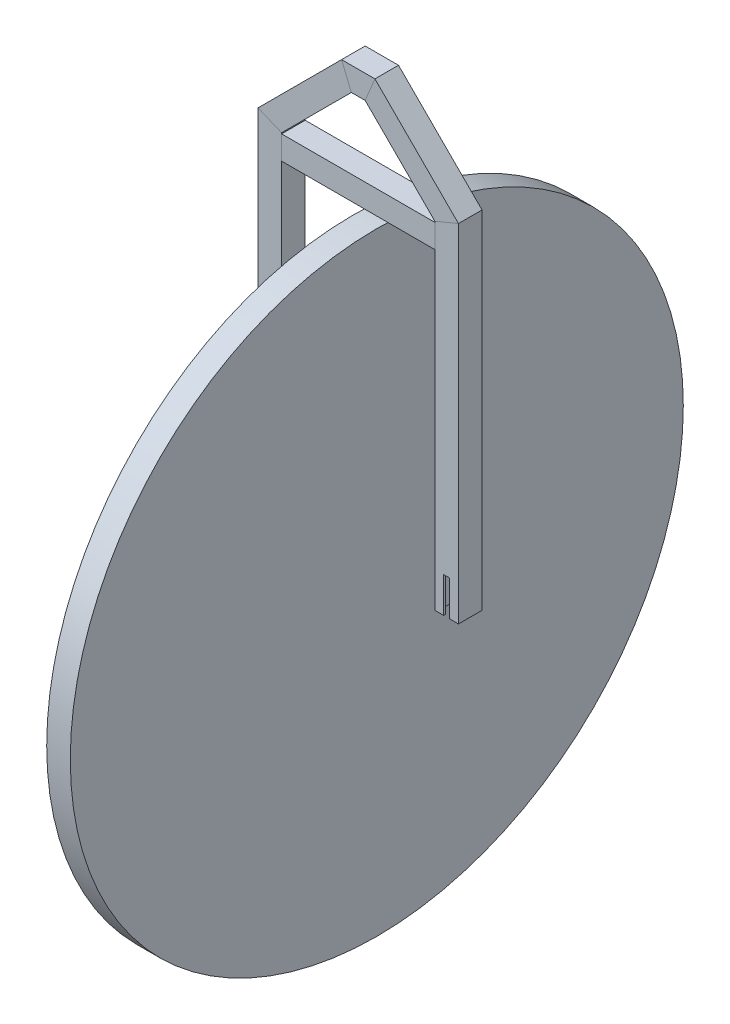
from build123d import *

# Parameters (mm, degrees)
WHEEL_START                                    = 6.404710745
WHEEL_OUTLINE_R                                = 330.2
WHEEL_DEPTH                                    = 25.4
SKETCH11_W                                     = 25.4
SKETCH11_H                                     = 25.4
SKETCH11_W_2                                   = 21.1836
SKETCH11_H_2                                   = 21.1836
AL_TUBE_SQUARE_AL_TUBE_1_SQR_X_0_083_WAL_DEPTH = 376.739487758
SKETCH11_ON_SEGMENT_2_W                        = 25.4
SKETCH11_ON_SEGMENT_2_H                        = 25.4
SKETCH11_ON_SEGMENT_2_W_2                      = 21.1836
SKETCH11_ON_SEGMENT_2_H_2                      = 21.1836
AL_TUBE_SQUARE_AL_TUBE_1_SQR_X_0_083_3_DEPTH   = 133.622305091
SKETCH11_ON_SEGMENT_3_W                        = 25.4
SKETCH11_ON_SEGMENT_3_H                        = 25.4
SKETCH11_ON_SEGMENT_3_W_2                      = 21.1836
SKETCH11_ON_SEGMENT_3_H_2                      = 21.1836
AL_TUBE_SQUARE_AL_TUBE_1_SQR_X_0_083_5_DEPTH   = 42.278975516
SKETCH11_ON_SEGMENT_4_W                        = 25.4
SKETCH11_ON_SEGMENT_4_H                        = 25.4
SKETCH11_ON_SEGMENT_4_W_2                      = 21.1836
SKETCH11_ON_SEGMENT_4_H_2                      = 21.1836
AL_TUBE_SQUARE_AL_TUBE_1_SQR_X_0_083_7_DEPTH   = 133.622305091
SKETCH11_ON_SEGMENT_5_W                        = 25.4
SKETCH11_ON_SEGMENT_5_H                        = 25.4
SKETCH11_ON_SEGMENT_5_W_2                      = 21.1836
SKETCH11_ON_SEGMENT_5_H_2                      = 21.1836
AL_TUBE_SQUARE_AL_TUBE_1_SQR_X_0_083_9_DEPTH   = 376.739487758
SKETCH11_ON_SEGMENT_6_W                        = 25.4
SKETCH11_ON_SEGMENT_6_H                        = 25.4
SKETCH11_ON_SEGMENT_6_W_2                      = 21.1836
SKETCH11_ON_SEGMENT_6_H_2                      = 21.1836
AL_TUBE_SQUARE_AL_TUBE_1_SQR_X_0_083_10_DEPTH  = 192.500000002
CUT_EXTRUDE1_DEPTH                             = 551.016675996
CUT_EXTRUDE1_DEPTH_BACK                        = 551.016675996
SKETCH16_W                                     = 6.35
SKETCH16_H                                     = 38.1


# Read off the part's stored shape, not the designer's step: wheel
with BuildPart() as part:
    # wheel outline → wheel (new body)
    with BuildSketch(Plane.YZ.offset(WHEEL_START)):
        with Locations((-85.120268568, 0)):
            Circle(WHEEL_OUTLINE_R)
    extrude(amount=WHEEL_DEPTH)


with BuildPart() as body_2:
    # Sketch11 → Al tube square AL TUBE 1 SQR X 0.083 WALL(1) (new body)
    with BuildSketch(Plane(origin=(-76.145289254, -72.509659064, -5.432195809), x_dir=(1, 0, 0), z_dir=(0, 1, 0))):
        Rectangle(SKETCH11_W, SKETCH11_H)
        Rectangle(SKETCH11_W_2, SKETCH11_H_2, mode=Mode.SUBTRACT)
    extrude(amount=AL_TUBE_SQUARE_AL_TUBE_1_SQR_X_0_083_WAL_DEPTH)

    # Al tube square AL TUBE 1 SQR X 0.083 2
    split(bisect_by=Plane(origin=(-76.145289254, 295.790340936, -5.432195809), x_dir=(0.923879533, -0.382683432, 0), z_dir=(-0.382683432, -0.923879533, 0)), keep=Keep.TOP)


with BuildPart() as body_3:
    # Sketch11 on segment 2 (carried to segment 2) → Al tube square AL TUBE 1 SQR X 0.083 3 (new body)
    with BuildSketch(Plane(origin=(-82.112908278, 289.822721913, -5.432195809), x_dir=(0.707106781, -0.707106781, 0), z_dir=(0.707106781, 0.707106781, 0))):
        Rectangle(SKETCH11_ON_SEGMENT_2_W, SKETCH11_ON_SEGMENT_2_H)
        Rectangle(SKETCH11_ON_SEGMENT_2_W_2, SKETCH11_ON_SEGMENT_2_H_2, mode=Mode.SUBTRACT)
    extrude(amount=AL_TUBE_SQUARE_AL_TUBE_1_SQR_X_0_083_3_DEPTH)

    # Al tube square AL TUBE 1 SQR X 0.083 3 m
    split(bisect_by=Plane(origin=(-76.145289254, 295.790340936, -5.432195809), x_dir=(-0.923879533, 0.382683432, 0), z_dir=(0.382683432, 0.923879533, 0)), keep=Keep.TOP)

    # Al tube square AL TUBE 1 SQR X 0.083 4
    split(bisect_by=Plane(origin=(6.404710747, 378.340340937, -5.432195809), x_dir=(0.382683432, -0.923879533, 0), z_dir=(-0.923879533, -0.382683432, 0)), keep=Keep.TOP)


with BuildPart() as body_4:
    # Sketch11 on segment 3 (carried to segment 3) → Al tube square AL TUBE 1 SQR X 0.083 5 (new body)
    with BuildSketch(Plane(origin=(-2.034777011, 378.340340937, -5.432195809), x_dir=(0, -1, 0), z_dir=(1, 0, 0))):
        Rectangle(SKETCH11_ON_SEGMENT_3_W, SKETCH11_ON_SEGMENT_3_H)
        Rectangle(SKETCH11_ON_SEGMENT_3_W_2, SKETCH11_ON_SEGMENT_3_H_2, mode=Mode.SUBTRACT)
    extrude(amount=AL_TUBE_SQUARE_AL_TUBE_1_SQR_X_0_083_5_DEPTH)

    # Al tube square AL TUBE 1 SQR X 0.083 5 m
    split(bisect_by=Plane(origin=(31.804710747, 378.340340937, -5.432195809), x_dir=(-0.382683432, -0.923879533, 0), z_dir=(-0.923879533, 0.382683432, 0)), keep=Keep.TOP)

    # Al tube square AL TUBE 1 SQR X 0.083 6
    split(bisect_by=Plane(origin=(6.404710747, 378.340340937, -5.432195809), x_dir=(-0.382683432, 0.923879533, 0), z_dir=(0.923879533, 0.382683432, 0)), keep=Keep.TOP)


with BuildPart() as body_5:
    # Sketch11 on segment 4 (carried to segment 4) → Al tube square AL TUBE 1 SQR X 0.083 7 (new body)
    with BuildSketch(Plane(origin=(25.837091724, 384.30795996, -5.432195809), x_dir=(-0.707106781, -0.707106781, 0), z_dir=(0.707106781, -0.707106781, 0))):
        Rectangle(SKETCH11_ON_SEGMENT_4_W, SKETCH11_ON_SEGMENT_4_H)
        Rectangle(SKETCH11_ON_SEGMENT_4_W_2, SKETCH11_ON_SEGMENT_4_H_2, mode=Mode.SUBTRACT)
    extrude(amount=AL_TUBE_SQUARE_AL_TUBE_1_SQR_X_0_083_7_DEPTH)

    # Al tube square AL TUBE 1 SQR X 0.083 7 m
    split(bisect_by=Plane(origin=(31.804710747, 378.340340937, -5.432195809), x_dir=(0.382683432, 0.923879533, 0), z_dir=(0.923879533, -0.382683432, 0)), keep=Keep.TOP)

    # Al tube square AL TUBE 1 SQR X 0.083 8
    split(bisect_by=Plane(origin=(114.354710748, 295.790340936, -5.432195809), x_dir=(-0.923879533, -0.382683432, 0), z_dir=(-0.382683432, 0.923879533, 0)), keep=Keep.TOP)


with BuildPart() as body_6:
    # Sketch11 on segment 5 (carried to segment 5) → Al tube square AL TUBE 1 SQR X 0.083 9 (new body)
    with BuildSketch(Plane(origin=(114.354710748, 304.229828694, -5.432195809), x_dir=(-1, 0, 0), z_dir=(0, -1, 0))):
        Rectangle(SKETCH11_ON_SEGMENT_5_W, SKETCH11_ON_SEGMENT_5_H)
        Rectangle(SKETCH11_ON_SEGMENT_5_W_2, SKETCH11_ON_SEGMENT_5_H_2, mode=Mode.SUBTRACT)
    extrude(amount=AL_TUBE_SQUARE_AL_TUBE_1_SQR_X_0_083_9_DEPTH)

    # Al tube square AL TUBE 1 SQR X 0.083 9 m
    split(bisect_by=Plane(origin=(114.354710748, 295.790340936, -5.432195809), x_dir=(0.923879533, 0.382683432, 0), z_dir=(0.382683432, -0.923879533, 0)), keep=Keep.TOP)


with BuildPart() as body_7:
    # Sketch11 on segment 6 (carried to segment 6) → Al tube square AL TUBE 1 SQR X 0.083 10 (new body)
    with BuildSketch(Plane(origin=(-77.145289254, 276.740340936, -5.432195809), x_dir=(0, -1, 0), z_dir=(1, 0, 0))):
        Rectangle(SKETCH11_ON_SEGMENT_6_W, SKETCH11_ON_SEGMENT_6_H)
        Rectangle(SKETCH11_ON_SEGMENT_6_W_2, SKETCH11_ON_SEGMENT_6_H_2, mode=Mode.SUBTRACT)
    extrude(amount=AL_TUBE_SQUARE_AL_TUBE_1_SQR_X_0_083_10_DEPTH)

    # Al tube square AL TUBE 1 SQR X 0.083 11
    split(bisect_by=Plane(origin=(-63.445289254, 276.740340936, -5.432195809), x_dir=(0, 1, 0), z_dir=(1, 0, 0)), keep=Keep.TOP)

    # Al tube square AL TUBE 1 SQR X 0.083 12
    split(bisect_by=Plane(origin=(101.654710748, 276.740340936, -5.432195809), x_dir=(0, -1, 0), z_dir=(-1, 0, 0)), keep=Keep.TOP)


with BuildPart() as cut_extrude1_tool:
    # Sketch16 → Cut-Extrude1 (new, two sides: drawn at the far end of the back side and taken through both)
    with BuildSketch(Plane.XY.offset(7.267804191).offset(-CUT_EXTRUDE1_DEPTH_BACK)):
        with Locations((-76.145289254, -53.459659064)):
            Rectangle(SKETCH16_W, SKETCH16_H)
        with Locations((114.354710748, -53.459659064)):
            Rectangle(SKETCH16_W, SKETCH16_H)
    extrude(amount=CUT_EXTRUDE1_DEPTH + CUT_EXTRUDE1_DEPTH_BACK)


with BuildPart() as body_2_1:
    add(body_2.part)

    # Cut-Extrude1: cut by cut_extrude1_tool
    add(cut_extrude1_tool.part, mode=Mode.SUBTRACT)


with BuildPart() as body_6_1:
    add(body_6.part)

    # Cut-Extrude1: cut by cut_extrude1_tool
    add(cut_extrude1_tool.part, mode=Mode.SUBTRACT)


solid = Compound([part.part, body_3.part, body_4.part, body_5.part, body_7.part, body_2_1.part, body_6_1.part])
